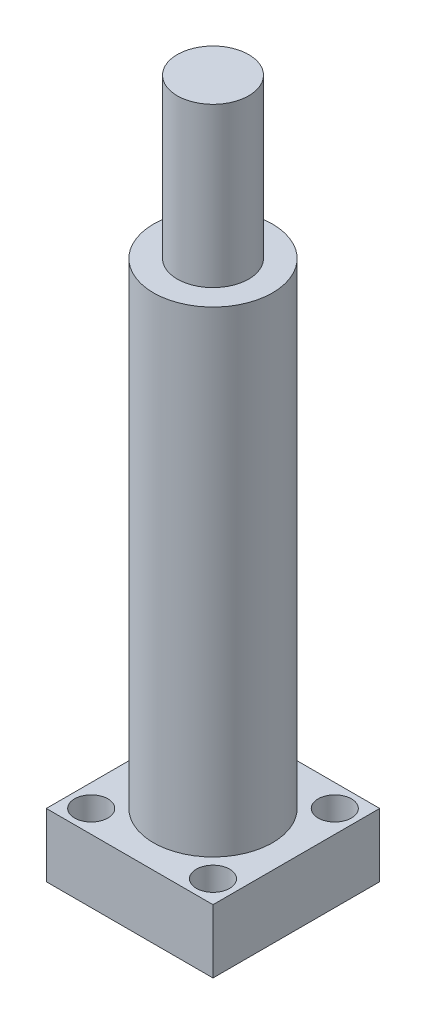
from build123d import *

# Parameters (mm, degrees)
SKETCH_1_R      = 7.5
EXTRUDE_1_DEPTH = 68
SKETCH_2_W      = 21
SKETCH_2_H      = 21
SKETCH_2_R      = 2.1
EXTRUDE_2_DEPTH = 8
SKETCH_3_R      = 4.5
EXTRUDE_3_DEPTH = 20


with BuildPart() as part:
    # 草图1 → 凸台-拉伸1 (new body)
    with BuildSketch(Plane(origin=(0, 0, 0), x_dir=(1, 0, 0), z_dir=(0, 1, 0))):
        Circle(SKETCH_1_R)
    extrude(amount=EXTRUDE_1_DEPTH)

    # 草图2 → 凸台-拉伸2 (add)
    with BuildSketch(Plane.XZ):
        Rectangle(SKETCH_2_W, SKETCH_2_H)
        with Locations((-7.671572875, 7.671572875)):
            Circle(SKETCH_2_R, mode=Mode.SUBTRACT)
        with Locations((7.671572875, -7.671572875)):
            Circle(SKETCH_2_R, mode=Mode.SUBTRACT)
        with Locations((7.671572875, 7.671572875)):
            Circle(SKETCH_2_R, mode=Mode.SUBTRACT)
        with Locations((-7.671572875, -7.671572875)):
            Circle(SKETCH_2_R, mode=Mode.SUBTRACT)
    extrude(amount=-EXTRUDE_2_DEPTH)

    # 草图3 → 凸台-拉伸3 (add)
    with BuildSketch(Plane(origin=(0, 68, 0), x_dir=(1, 0, 0), z_dir=(0, 1, 0))):
        Circle(SKETCH_3_R)
    extrude(amount=EXTRUDE_3_DEPTH)


solid = part.part
